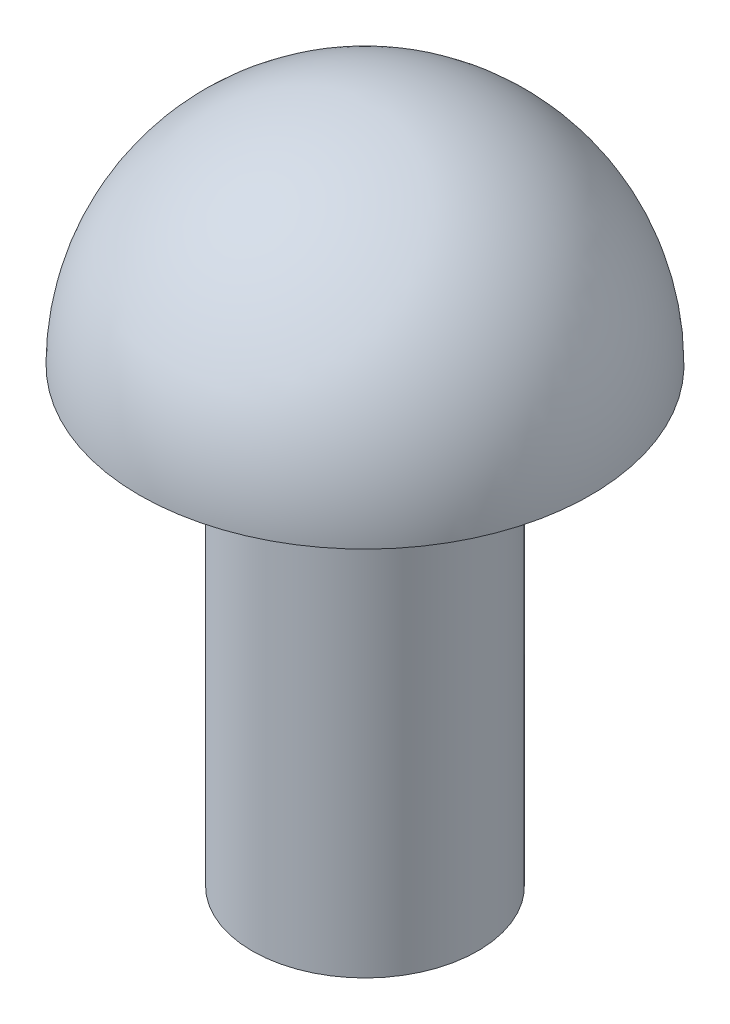
from build123d import *

# Parameters (mm, degrees)
SKETCH1_R           = 2.5
BOSS_EXTRUDE1_DEPTH = 10
SKETCH2_R           = 5
BOSS_EXTRUDE2_DEPTH = 5
FILLET1_R           = 5


with BuildPart() as part:
    # Sketch1 → Boss-Extrude1 (new body)
    with BuildSketch(Plane(origin=(0, 0, 0), x_dir=(1, 0, 0), z_dir=(0, 1, 0))):
        with Locations(Location((0, 0, 0), (0, 0, 270))):
            Circle(SKETCH1_R)
    extrude(amount=-BOSS_EXTRUDE1_DEPTH)

    # Sketch2 → Boss-Extrude2 (add)
    with BuildSketch(Plane(origin=(0, 0, 0), x_dir=(1, 0, 0), z_dir=(0, 1, 0))):
        with Locations(Location((0, 0, 0), (0, 0, 270))):
            Circle(SKETCH2_R)
    extrude(amount=BOSS_EXTRUDE2_DEPTH)

    # Fillet1
    fillet1_edges = [part.edges().sort_by_distance(p)[0] for p in [
        (0, 5, -5),
    ]]
    fillet(fillet1_edges, radius=FILLET1_R - 0.0001)  # a hair under: the kernel refuses the full size


solid = part.part
